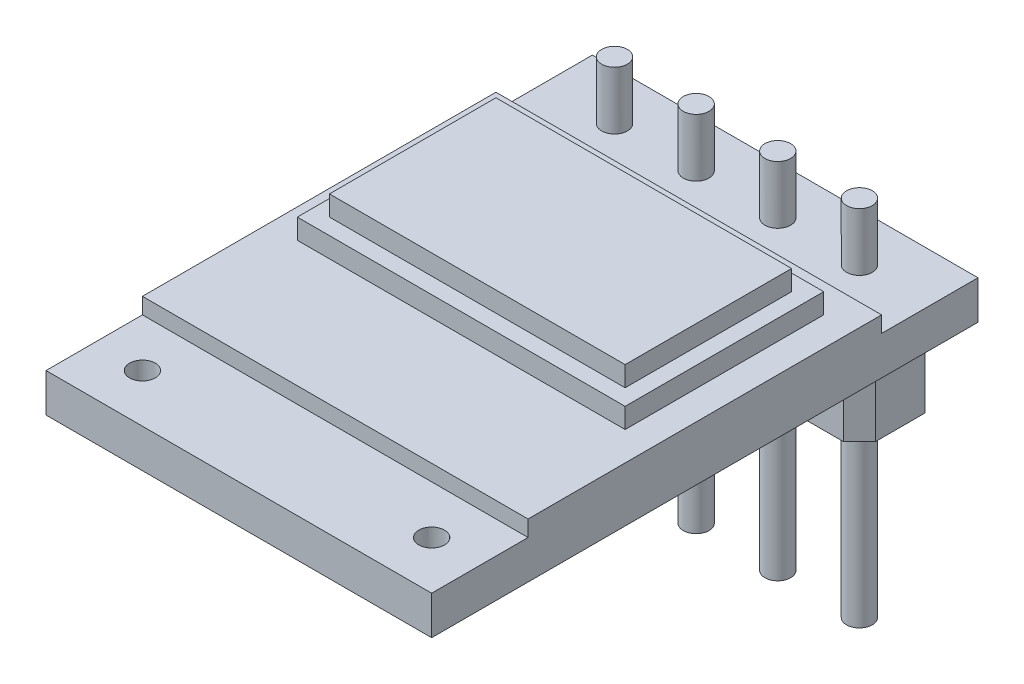
from build123d import *

# Parameters (mm, degrees)
SKETCH1_W               = 12
SKETCH1_H               = 17
BOSS_EXTRUDE1_DEPTH     = 1.2
SKETCH2_W               = 12
SKETCH2_H               = 11
BOSS_EXTRUDE2_DEPTH     = 0.5
SKETCH3_R               = 0.4
CUT_EXTRUDE1_DEPTH      = 12.723480712
SKETCH4_W               = 10.2
SKETCH4_H               = 6.18
BOSS_EXTRUDE3_DEPTH     = 0.625
SKETCH5_W               = 9.2
SKETCH5_H               = 5.18
BOSS_EXTRUDE4_DEPTH     = 0.625
SKETCH6_R               = 0.4
BOSS_EXTRUDE5_DEPTH     = 2.54
BOSS_EXTRUDE6_START     = -3
BOSS_EXTRUDE6_OUTLINE_R = 0.4
BOSS_EXTRUDE6_DEPTH     = 11.3


# Read off the part's stored shape, not the designer's step: Boss-Extrude6
with BuildPart() as part:
    # Sketch1 → Boss-Extrude1 (new body)
    with BuildSketch(Plane(origin=(0, 0, 0), x_dir=(1, 0, 0), z_dir=(0, 1, 0))):
        with Locations((0, 1.5)):
            Rectangle(SKETCH1_W, SKETCH1_H)
    extrude(amount=BOSS_EXTRUDE1_DEPTH)

    # Sketch2 → Boss-Extrude2 (add)
    with BuildSketch(Plane(origin=(0, 1.2, 0), x_dir=(1, 0, 0), z_dir=(0, 1, 0))):
        with Locations((0, 1.5)):
            Rectangle(SKETCH2_W, SKETCH2_H)
    extrude(amount=BOSS_EXTRUDE2_DEPTH)

    # Sketch3 → Cut-Extrude1 (cut, through all)
    with BuildSketch(Plane(origin=(0, 1.2, 0), x_dir=(1, 0, 0), z_dir=(0, 1, 0))):
        with Locations(Location((-3.81, 8.5, 0), (0, 0, 270))):
            Circle(SKETCH3_R)
        with Locations(Location((-4.5, -5.5, 0), (0, 0, 270))):
            Circle(SKETCH3_R)
        with Locations(Location((4.5, -5.5, 0), (0, 0, 270))):
            Circle(SKETCH3_R)
        with Locations(Location((-1.27, 8.5, 0), (0, 0, 270))):
            Circle(SKETCH3_R)
        with Locations(Location((1.27, 8.5, 0), (0, 0, 270))):
            Circle(SKETCH3_R)
        with Locations(Location((3.81, 8.5, 0), (0, 0, 270))):
            Circle(SKETCH3_R)
    extrude(amount=-CUT_EXTRUDE1_DEPTH, mode=Mode.SUBTRACT)

    # Sketch4 → Boss-Extrude3 (add)
    with BuildSketch(Plane(origin=(0, 1.7, 0), x_dir=(1, 0, 0), z_dir=(0, 1, 0))):
        with Locations((0, 3.01)):
            Rectangle(SKETCH4_W, SKETCH4_H)
    extrude(amount=BOSS_EXTRUDE3_DEPTH)

    # Sketch5 → Boss-Extrude4 (add)
    with BuildSketch(Plane(origin=(0, 2.325, 0), x_dir=(1, 0, 0), z_dir=(0, 1, 0))):
        with Locations((0, 3.01)):
            Rectangle(SKETCH5_W, SKETCH5_H)
    extrude(amount=BOSS_EXTRUDE4_DEPTH)

    # Sketch6 → Boss-Extrude5 (add)
    with BuildSketch(Plane.XZ):
        Polygon((-3.04, -7.23), (-4.58, -7.23), (-5.08, -7.73), (-5.08, -9.27), (-4.58, -9.77), (-3.04, -9.77), (-2.54, -9.27), (-2.04, -9.77), (-0.5, -9.77), (0, -9.27), (0.5, -9.77), (2.04, -9.77), (2.54, -9.27), (3.04, -9.77), (4.58, -9.77), (5.08, -9.27), (5.08, -7.73), (4.58, -7.23), (3.04, -7.23), (2.54, -7.73), (2.04, -7.23), (0.5, -7.23), (0, -7.73), (-0.5, -7.23), (-2.04, -7.23), (-2.54, -7.73), align=None)
        with Locations(Location((-3.81, -8.5, 0), (0, 0, 90))):
            Circle(SKETCH6_R, mode=Mode.SUBTRACT)
        with Locations(Location((-1.27, -8.5, 0), (0, 0, 90))):
            Circle(SKETCH6_R, mode=Mode.SUBTRACT)
        with Locations(Location((1.27, -8.5, 0), (0, 0, 90))):
            Circle(SKETCH6_R, mode=Mode.SUBTRACT)
        with Locations(Location((3.81, -8.5, 0), (0, 0, 90))):
            Circle(SKETCH6_R, mode=Mode.SUBTRACT)
    extrude(amount=BOSS_EXTRUDE5_DEPTH)

    # Boss-Extrude6 outline → Boss-Extrude6 (add)
    with BuildSketch(Plane.XZ.offset(BOSS_EXTRUDE6_START)):
        with Locations((-3.81, -8.5)):
            Circle(BOSS_EXTRUDE6_OUTLINE_R)
        with Locations((-1.27, -8.5)):
            Circle(BOSS_EXTRUDE6_OUTLINE_R)
        with Locations((1.27, -8.5)):
            Circle(BOSS_EXTRUDE6_OUTLINE_R)
        with Locations((3.81, -8.5)):
            Circle(BOSS_EXTRUDE6_OUTLINE_R)
    extrude(amount=BOSS_EXTRUDE6_DEPTH)


solid = part.part
